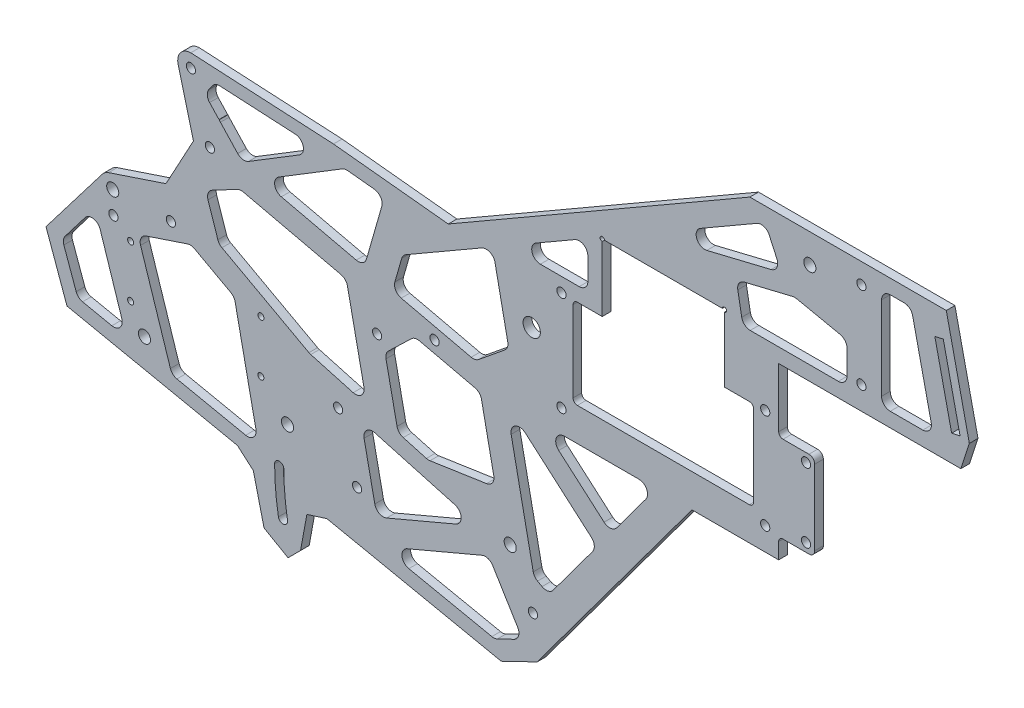
from build123d import *

# Parameters (mm, degrees)
SKETCH1_W            = 163.178820173
SKETCH1_H            = 83.61431582
BOSS_EXTRUDE1_DEPTH  = 3
SKETCH2_R            = 3
CUT_EXTRUDE1_DEPTH   = 70
SKETCH3_R            = 1.6
BOSS_EXTRUDE2_DEPTH  = 3
CUT_EXTRUDE2_DEPTH   = 10
SKETCH6_R            = 2.1
CUT_EXTRUDE3_DEPTH   = 10
SKETCH7_R            = 1.6
CUT_EXTRUDE4_DEPTH   = 10
SKETCH8_R            = 1.05
CUT_EXTRUDE5_DEPTH   = 10
CUT_EXTRUDE6_DEPTH   = 10
BOSS_EXTRUDE3_DEPTH  = 3
SKETCH11_R           = 1.599999999
CUT_EXTRUDE7_DEPTH   = 3
SKETCH12_R           = 1.6
CUT_EXTRUDE8_DEPTH   = 3
BOSS_EXTRUDE4_DEPTH  = 3
CUT_EXTRUDE11_DEPTH  = 3
CUT_EXTRUDE13_DEPTH  = 3
SKETCH19_R           = 1.6
CUT_EXTRUDE14_DEPTH  = 3
SKETCH20_R           = 1.6
CUT_EXTRUDE15_DEPTH  = 3
CUT_EXTRUDE16_DEPTH  = 10
FILLET2_R            = 3
BOSS_EXTRUDE5_DEPTH  = 3
CUT_EXTRUDE17_DEPTH  = 3
BOSS_EXTRUDE6_DEPTH  = 3
CUT_EXTRUDE18_DEPTH  = 3
SKETCH27_W           = 9.650782697
SKETCH27_H           = 7.834164778
BOSS_EXTRUDE7_DEPTH  = 3
SKETCH28_R           = 2.1
CUT_EXTRUDE19_DEPTH  = 3
BOSS_EXTRUDE8_START  = -3
BOSS_EXTRUDE8_DEPTH  = 3
CUT_EXTRUDE20_DEPTH  = 3
BOSS_EXTRUDE9_DEPTH  = 3
CUT_EXTRUDE21_DEPTH  = 10
BOSS_EXTRUDE10_DEPTH = 3
FILLET3_R            = 3
BOSS_EXTRUDE11_DEPTH = 3
CUT_EXTRUDE22_DEPTH  = 10
BOSS_EXTRUDE12_DEPTH = 3
BOSS_EXTRUDE13_DEPTH = 3
CUT_EXTRUDE23_DEPTH  = 3
FILLET4_R            = 3


with BuildPart() as part:
    # Sketch1 → Boss-Extrude1 (new body)
    with BuildSketch(Plane.XY):
        with Locations((-102.048100406, 5.79284209)):
            Rectangle(SKETCH1_W, SKETCH1_H)
    extrude(amount=BOSS_EXTRUDE1_DEPTH)

    # Sketch2 → Cut-Extrude1 (cut)
    with BuildSketch(Plane.XY.offset(3)):
        with Locations((-24.288671568, 24)):
            Circle(SKETCH2_R)
    extrude(amount=-CUT_EXTRUDE1_DEPTH, mode=Mode.SUBTRACT)

    # Sketch3 → Boss-Extrude2 (add)
    # profile 1 of 2: a face of its own
    with BuildSketch(Plane.XY.offset(3)):
        with BuildLine():
            Line((-20.45869032, -36.01431582), (-20.45869032, 47.6))
            Line((-20.45869032, 47.6), (-41.120184692, 47.6))
            Line((-41.120184692, 47.6), (51.371328432, 101))
            Line((51.371328432, 101), (121.371328432, 101))
            Line((121.371328432, 101), (121.371328432, 56))
            Line((121.371328432, 56), (61.371328432, 56))
            Line((61.371328432, 56), (61.371328432, 35.5))
            ThreePointArc((61.371328432, 35.5), (61.810668261, 34.439339828), (62.871328432, 34))
            Line((62.871328432, 34), (71.871328432, 34))
            ThreePointArc((71.871328432, 34), (73.285541995, 33.414213562), (73.871328432, 32))
            Line((73.871328432, 32), (73.871328432, 6))
            ThreePointArc((73.871328432, 6), (73.285541995, 4.585786438), (71.871328432, 4))
            Line((71.871328432, 4), (62.871328432, 4))
            ThreePointArc((62.871328432, 4), (61.810668261, 3.560660172), (61.371328432, 2.5))
            Line((61.371328432, 2.5), (61.371328432, -26))
            Line((61.371328432, -26), (-34.873017797, -81.566699204))
            Line((-34.873017797, -81.566699204), (-204.873017797, -81.566699204))
            Line((-204.873017797, -81.566699204), (-204.873017797, 47.6))
            Line((-204.873017797, 47.6), (-183.637510493, 47.6))
            Line((-183.637510493, 47.6), (-183.637510493, -36.01431582))
            Line((-183.637510493, -36.01431582), (-20.45869032, -36.01431582))
        make_face()
        with Locations((70.871328432, 31)):
            Circle(SKETCH3_R, mode=Mode.SUBTRACT)
        with Locations((70.871328432, 7)):
            Circle(SKETCH3_R, mode=Mode.SUBTRACT)
    # profile 2 of 2: a face of its own
    with BuildSketch(Plane.XY.offset(3)):
        with BuildLine():
            Line((-167.85268014, 47.6), (-120.724662995, 47.6))
            ThreePointArc((-120.724662995, 47.6), (-144.288671568, 57.35), (-167.85268014, 47.6))
        make_face()
    extrude(amount=-BOSS_EXTRUDE2_DEPTH)

    # Sketch4 → Cut-Extrude2 (cut)
    with BuildSketch(Plane.XY.offset(3)):
        with BuildLine():
            Line((0.171328432, 62.05), (0.171328432, 39.5))
            Line((0.171328432, 39.5), (-8.45869032, 39.5))
            ThreePointArc((-8.45869032, 39.5), (-9.519350491, 39.060660172), (-9.95869032, 38))
            Line((-9.95869032, 38), (-9.95869032, 10))
            ThreePointArc((-9.95869032, 10), (-9.519350491, 8.939339828), (-8.45869032, 8.5))
            Line((-8.45869032, 8.5), (51.201347185, 8.5))
            ThreePointArc((51.201347185, 8.5), (52.262007356, 8.939339828), (52.701347185, 10))
            Line((52.701347185, 10), (52.701347185, 38))
            ThreePointArc((52.701347185, 38), (52.262007356, 39.060660172), (51.201347185, 39.5))
            Line((51.201347185, 39.5), (42.571328432, 39.5))
            Line((42.571328432, 39.5), (42.571328432, 62.05))
            ThreePointArc((42.571328432, 62.05), (43.101658518, 63.330330086), (41.821328432, 62.8))
            Line((41.821328432, 62.8), (0.921328432, 62.8))
            ThreePointArc((0.921328432, 62.8), (-0.359001653, 63.330330086), (0.171328432, 62.05))
        make_face()
    extrude(amount=-CUT_EXTRUDE2_DEPTH, mode=Mode.SUBTRACT)

    # Sketch6 → Cut-Extrude3 (cut)
    with BuildSketch(Plane(origin=(0, 0, 0), x_dir=(-1, 0, 0), z_dir=(0, 0, -1))):
        with Locations((158.638149135, -45.925703464)):
            Circle(SKETCH6_R)
        with Locations((169.638438212, -7.233826143)):
            Circle(SKETCH6_R)
        with Locations((109.011892198, -47.513424086)):
            Circle(SKETCH6_R)
        with Locations((31.755599014, -45.033004622)):
            Circle(SKETCH6_R)
        with Locations((-71.971715393, 91)):
            Circle(SKETCH6_R)
    extrude(amount=-CUT_EXTRUDE3_DEPTH, mode=Mode.SUBTRACT)

    # Sketch7 → Cut-Extrude4 (cut)
    with BuildSketch(Plane.XY.offset(3)):
        with Locations((56.701347185, 5)):
            Circle(SKETCH7_R)
        with Locations((-13.95869032, 5)):
            Circle(SKETCH7_R)
        with Locations((56.701347185, 39.6)):
            Circle(SKETCH7_R)
        with Locations((-13.95869032, 39.6)):
            Circle(SKETCH7_R)
    extrude(amount=-CUT_EXTRUDE4_DEPTH, mode=Mode.SUBTRACT)

    # Sketch8 → Cut-Extrude5 (cut)
    with BuildSketch(Plane(origin=(0, 0, 0), x_dir=(-1, 0, 0), z_dir=(0, 0, -1))):
        with Locations((163.428671568, -37.666699204)):
            Circle(SKETCH8_R)
        with Locations((163.428671568, -19.666699204)):
            Circle(SKETCH8_R)
        with Locations((118.228671568, -37.666699204)):
            Circle(SKETCH8_R)
        with Locations((118.228671568, -19.666699204)):
            Circle(SKETCH8_R)
    extrude(amount=-CUT_EXTRUDE5_DEPTH, mode=Mode.SUBTRACT)

    # Sketch9 → Cut-Extrude6 (cut)
    with BuildSketch(Plane(origin=(0, 0, 0), x_dir=(-1, 0, 0), z_dir=(0, 0, -1))):
        Polygon((-121.371328432, 56), (-118.426654556, 56), (-121.371328432, 65.062774312), align=None)
        Polygon((-121.371328432, 101), (-121.371328432, 65.062774312), (-113.371328432, 101), align=None)
        Polygon((-61.371328432, -26), (-17.266880789, -51.463714719), (-61.371328432, 0.5), align=None)
        Polygon((120.863159172, -67.292179678), (117.404541062, -81.566699204), (204.873017797, -81.566699204), (204.873017797, 23.999750834), (177.638416387, 23.999750834), (177.638416387, -10.155091534), (192.781858404, -29.966985111), (185.497426915, -50.178485254), (126.348521803, -62.504365896), align=None)
        Polygon((95.344552433, -68.965199366), (34.873017797, -81.566699204), (104.200298052, -81.566699204), (102.285728481, -71.163480303), align=None)
        with BuildLine():
            Line((-83.571328432, 61), (-50.244806955, 61))
            ThreePointArc((-50.244806955, 61), (-49.282311579, 61.349520686), (-48.768365596, 62.235196464))
            Line((-48.768365596, 62.235196464), (-46.599577608, 74.327513426))
            ThreePointArc((-46.599577608, 74.327513426), (-46.819419687, 75.411437373), (-47.722417082, 76.050043173))
            Line((-47.722417082, 76.050043173), (-65.520386191, 80.367311648))
            ThreePointArc((-65.520386191, 80.367311648), (-65.90752568, 80.409210466), (-66.292404996, 80.350046224))
            Line((-66.292404996, 80.350046224), (-83.989745353, 75.209422674))
            ThreePointArc((-83.989745353, 75.209422674), (-84.770833618, 74.669621261), (-85.071328432, 73.768961886))
            Line((-85.071328432, 73.768961886), (-85.071328432, 62.5))
            ThreePointArc((-85.071328432, 62.5), (-84.631988604, 61.439339828), (-83.571328432, 61))
        make_face()
        with BuildLine():
            Line((-59.519671277, 85.08571202), (-25.314151563, 76.788450066))
            ThreePointArc((-25.314151563, 76.788450066), (-23.567990796, 77.688700037), (-24.210549679, 79.545214383))
            Line((-24.210549679, 79.545214383), (-54.279336826, 96.905436737))
            ThreePointArc((-54.279336826, 96.905436737), (-55.48620894, 97.035128092), (-56.393908981, 96.229249204))
            Line((-56.393908981, 96.229249204), (-60.530641547, 87.166288803))
            ThreePointArc((-60.530641547, 87.166288803), (-60.515228555, 85.887870115), (-59.519671277, 85.08571202))
        make_face()
    extrude(amount=-CUT_EXTRUDE6_DEPTH, mode=Mode.SUBTRACT)

    # Sketch10 → Boss-Extrude3 (add)
    with BuildSketch(Plane.XY.offset(3)):
        Polygon((17.266880789, -51.463714719), (10.205824418, -59.783091395), (-34.873017797, -81.566699204), align=None)
    extrude(amount=-BOSS_EXTRUDE3_DEPTH)

    # Sketch11 → Cut-Extrude7 (cut)
    with BuildSketch(Plane(origin=(0, 0, 0), x_dir=(-1, 0, 0), z_dir=(0, 0, -1))):
        with Locations((23.873017796, -61.566699204)):
            Circle(SKETCH11_R)
        with BuildLine():
            Line((182.025550468, -45.065004546), (186.87611918, -31.606539001))
            ThreePointArc((186.87611918, -31.606539001), (186.947368829, -30.868815154), (186.656707601, -30.187031436))
            Line((186.656707601, -30.187031436), (177.493744222, -18.199290795))
            ThreePointArc((177.493744222, -18.199290795), (176.049674571, -17.631583295), (174.875617511, -18.646087598))
            Line((174.875617511, -18.646087598), (165.680025858, -46.907186583))
            ThreePointArc((165.680025858, -46.907186583), (165.989490672, -48.37254203), (167.412424949, -48.839760499))
            Line((167.412424949, -48.839760499), (180.920411269, -46.0248677))
            ThreePointArc((180.920411269, -46.0248677), (181.598013954, -45.688893065), (182.025550468, -45.065004546))
        make_face()
        with BuildLine():
            ThreePointArc((112.161770205, -76.839426476), (110.312458067, -78.143284068), (109.008600476, -76.293971931))
            ThreePointArc((109.008600476, -76.293971931), (109.956333089, -68.957425033), (110.273017797, -61.566699204))
            ThreePointArc((110.273017797, -61.566699204), (111.873017797, -59.966699204), (113.473017797, -61.566699204))
            ThreePointArc((113.473017797, -61.566699204), (113.144604026, -69.231155619), (112.161770205, -76.839426476))
        make_face()
    extrude(amount=-CUT_EXTRUDE7_DEPTH, mode=Mode.SUBTRACT)

    # Sketch12 → Cut-Extrude8 (cut)
    with BuildSketch(Plane(origin=(0, 0, 0), x_dir=(-1, 0, 0), z_dir=(0, 0, -1))):
        with Locations((-90.071328432, 94)):
            Circle(SKETCH12_R)
        with Locations((-90.071328432, 64)):
            Circle(SKETCH12_R)
    extrude(amount=-CUT_EXTRUDE8_DEPTH, mode=Mode.SUBTRACT)

    # Sketch15 → Boss-Extrude4 (add)
    with BuildSketch(Plane.XY.offset(3)):
        Polygon((-104.200298052, -81.566699204), (-117.404541062, -81.566699204), (-117.138244406, -82.665767299), (-108.829298455, -87.46293948), (-104.486117245, -83.11975827), align=None)
    extrude(amount=-BOSS_EXTRUDE4_DEPTH)

    # Sketch16 → Cut-Extrude11 (cut)
    with BuildSketch(Plane(origin=(0, 0, 0), x_dir=(-1, 0, 0), z_dir=(0, 0, -1))):
        with BuildLine():
            Line((11.269813629, -56.833195156), (-11.308333697, -45.922677445))
            ThreePointArc((-11.308333697, -45.922677445), (-11.573688093, -45.758389309), (-11.799301923, -45.542746209))
            Line((-11.799301923, -45.542746209), (-23.657583502, -31.571343289))
            ThreePointArc((-23.657583502, -31.571343289), (-23.983253255, -30.298686205), (-23.182005599, -29.257667936))
            Line((-23.182005599, -29.257667936), (27.44914468, -4.073328722))
            ThreePointArc((27.44914468, -4.073328722), (29.031447568, -4.227194459), (29.586779853, -5.716812915))
            Line((29.586779853, -5.716812915), (22.360247475, -41.063740234))
            ThreePointArc((22.360247475, -41.063740234), (22.286714803, -41.311914547), (22.171611839, -41.543752532))
            Line((22.171611839, -41.543752532), (13.203422842, -56.263085058))
            ThreePointArc((13.203422842, -56.263085058), (12.346666546, -56.921384552), (11.269813629, -56.833195156))
        make_face()
        with BuildLine():
            Line((0.460063561, -6.329141418), (-30.511103642, -21.734447764))
            ThreePointArc((-30.511103642, -21.734447764), (-31.481149764, -21.86069911), (-32.322749626, -21.362062417))
            Line((-32.322749626, -21.362062417), (-41.014940376, -11.120941188))
            ThreePointArc((-41.014940376, -11.120941188), (-41.279415418, -10.66729816), (-41.371328432, -10.150296184))
            Line((-41.371328432, -10.150296184), (-41.371328432, -1))
            ThreePointArc((-41.371328432, -1), (-40.931988604, 0.060660172), (-39.871328432, 0.5))
            Line((-39.871328432, 0.5), (-2.774938255, 0.5))
            ThreePointArc((-2.774938255, 0.5), (-2.05667802, 0.316853156), (-1.513813912, -0.187863686))
            Line((-1.513813912, -0.187863686), (1.053153863, -4.173974755))
            ThreePointArc((1.053153863, -4.173974755), (1.238265619, -5.384107483), (0.460063561, -6.329141418))
        make_face()
    extrude(amount=-CUT_EXTRUDE11_DEPTH, mode=Mode.SUBTRACT)

    # Sketch18 → Cut-Extrude13 (cut)
    with BuildSketch(Plane(origin=(0, 0, 0), x_dir=(-1, 0, 0), z_dir=(0, 0, -1))):
        with BuildLine():
            Line((7.078671568, 61.480374074), (31.641465984, 47.299038106))
            ThreePointArc((31.641465984, 47.299038106), (32.340354723, 45.611771432), (30.891465984, 44.5))
            Line((30.891465984, 44.5), (6.328671568, 44.5))
            ThreePointArc((6.328671568, 44.5), (5.268011396, 44.939339828), (4.828671568, 46))
            Line((4.828671568, 46), (4.828671568, 60.181335968))
            ThreePointArc((4.828671568, 60.181335968), (5.578671568, 61.480374074), (7.078671568, 61.480374074))
        make_face()
    extrude(amount=-CUT_EXTRUDE13_DEPTH, mode=Mode.SUBTRACT)

    # Sketch19 → Cut-Extrude14 (cut)
    with BuildSketch(Plane.XY.offset(3)):
        with Locations((-91.456581964, -33.768910916)):
            Circle(SKETCH19_R)
        with Locations((-77.932797588, -4.767061731)):
            Circle(SKETCH19_R)
        with Locations((-149.460280334, -6.721342165)):
            Circle(SKETCH19_R)
        with Locations((-135.936495958, 22.28050702)):
            Circle(SKETCH19_R)
    extrude(amount=-CUT_EXTRUDE14_DEPTH, mode=Mode.SUBTRACT)

    # Sketch20 → Cut-Extrude15 (cut)
    with BuildSketch(Plane.XY.offset(3)):
        with Locations((-84.882257407, -54.288012188)):
            Circle(SKETCH20_R)
        with Locations((-169.404718208, -14.874541431)):
            Circle(SKETCH20_R)
        with Locations((-57.988359714, 3.386137535)):
            Circle(SKETCH20_R)
        with Locations((-142.510820515, 42.799608292)):
            Circle(SKETCH20_R)
    extrude(amount=-CUT_EXTRUDE15_DEPTH, mode=Mode.SUBTRACT)

    # Sketch22 → Cut-Extrude16 (cut)
    with BuildSketch(Plane.XY.offset(3)):
        Polygon((-76.323063278, -67.821626648), (-37.12340227, -75.990338172), (-27.451490646, -71.316546228), (-39.179035785, -52.068330489), align=None)
        Polygon((-77.983418544, -59.836051226), (-42.685868934, -44.865871894), (-83.448422948, -33.551794033), align=None)
        Polygon((-149.086127131, -52.658728223), (-119.028870525, -58.922278776), (-127.462526406, -18.360119284), (-142.442614642, -10.200196554), (-160.898506599, -16.355373525), align=None)
        Polygon((-70.641334575, -30.879704934), (-60.206198021, -33.776087418), (-36.814607718, -30.27291745), (-42.103534989, -4.403341551), (-64.859698343, 0.873326667), (-75.175214792, -9.073743787), align=None)
        Polygon((-101.272422836, -22.377722516), (-81.48074435, -27.871112143), (-88.601929516, 6.37864295), (-125.455396048, 14.924174661), (-137.395178961, 8.598466493), (-132.790132757, -5.209460651), align=None)
        Polygon((-72.633756132, 10.888219669), (-43.866051353, 4.2176034), (-32.236910384, 13.698978577), (-37.532266562, 39.6), (-64.39852118, 39.6), align=None)
        Polygon((-124.003413949, 22.799746078), (-82.388214325, 13.150070172), (-74.801732954, 39.6), (-129.551973108, 39.6), (-133.929024166, 33.445565282), align=None)
        with BuildLine():
            ThreePointArc((-173.278699338, -4.451351915), (-172.300812969, -3.504828349), (-171.088038255, -2.887296078))
            Line((-171.088038255, -2.887296078), (-151.16672967, 3.756608217))
            Line((-151.16672967, 3.756608217), (-141.642344482, 21.323123168))
            Line((-141.642344482, 21.323123168), (-146.944270243, 41.642807792))
            ThreePointArc((-146.944270243, 41.642807792), (-146.150685692, 45.582600456), (-142.556724513, 47.381262657))
            Line((-142.556724513, 47.381262657), (-120.724662995, 47.6))
            Line((-120.724662995, 47.6), (-129.551973108, 69.988968949))
            Line((-129.551973108, 69.988968949), (-217.973119112, 55.746414592))
            Line((-217.973119112, 55.746414592), (-212.066553709, -12.704566552))
            Line((-212.066553709, -12.704566552), (-177.638416387, -10.155091534))
            Line((-177.638416387, -10.155091534), (-173.278699338, -4.451351915))
        make_face()
    extrude(amount=-CUT_EXTRUDE16_DEPTH, mode=Mode.SUBTRACT)

    # Fillet2
    fillet2_edges = [part.edges().sort_by_distance(p)[0] for p in [
        (-37.532266562, 39.6, 1.5),
        (-64.39852118, 39.6, 1.5),
        (-32.236910384, 13.698978577, 1.5),
        (-43.866051353, 4.2176034, 1.5),
        (-82.388214325, 13.150070172, 1.5),
        (-72.633756132, 10.888219669, 1.5),
        (-124.003413949, 22.799746078, 1.5),
        (-132.790132757, -5.209460651, 1.5),
        (-101.272422836, -22.377722516, 1.5),
        (-81.48074435, -27.871112143, 1.5),
        (-133.929024166, 33.445565282, 1.5),
        (-129.551973108, 39.6, 1.5),
        (-137.395178961, 8.598466493, 1.5),
        (-160.898506599, -16.355373525, 1.5),
        (-88.601929516, 6.37864295, 1.5),
        (-74.801732954, 39.6, 1.5),
        (-125.455396048, 14.924174661, 1.5),
        (-142.442614642, -10.200196554, 1.5),
        (-127.462526406, -18.360119284, 1.5),
        (-119.028870525, -58.922278776, 1.5),
        (-149.086127131, -52.658728223, 1.5),
        (-70.641334575, -30.879704934, 1.5),
        (-60.206198021, -33.776087418, 1.5),
        (-42.103534989, -4.403341551, 1.5),
        (-36.814607718, -30.27291745, 1.5),
        (-64.859698343, 0.873326667, 1.5),
        (-75.175214792, -9.073743787, 1.5),
        (-83.448422948, -33.551794033, 1.5),
        (-77.983418544, -59.836051226, 1.5),
        (-76.323063278, -67.821626648, 1.5),
        (-39.179035785, -52.068330489, 1.5),
        (-42.685868934, -44.865871894, 1.5),
        (-37.12340227, -75.990338172, 1.5),
        (-27.451490646, -71.316546228, 1.5),
    ]]
    fillet(fillet2_edges, radius=FILLET2_R)

    # Sketch23 → Boss-Extrude5 (add)
    with BuildSketch(Plane.XY.offset(3)):
        Polygon((-15.130171081, -62.379709124), (12.218349603, -50.696677847), (46.16570151, -12.476032853), (46.16570151, 2.450417003), (-9.12929613, 2.450417003), (-16.222708995, -2.830663341), (-26.155021538, 1.279347742), (-39.106449794, -4.253380816), align=None)
        Polygon((61.371328432, 0.5), (52.84665155, -9.543746181), (61.371328432, -9.543746181), align=None)
    extrude(amount=-BOSS_EXTRUDE5_DEPTH)

    # Sketch24 → Cut-Extrude17 (cut)
    with BuildSketch(Plane.XY.offset(3)):
        Polygon((61.371328432, -3), (31.291839697, -3), (-22.417752101, -75.547897261), (68.077642892, -67.653931132), align=None)
        with BuildLine():
            Line((-17.629067029, -52.273335738), (-2.34146226, -31.623698624))
            ThreePointArc((-2.34146226, -31.623698624), (-2.055985305, -30.567540627), (-2.563723837, -29.59843362))
            Line((-2.563723837, -29.59843362), (-29.865870718, -5.898001252))
            ThreePointArc((-29.865870718, -5.898001252), (-31.605904572, -5.735610031), (-32.318781219, -7.331196321))
            Line((-32.318781219, -7.331196321), (-23.627770884, -49.841282013))
            ThreePointArc((-23.627770884, -49.841282013), (-23.367180513, -50.428686818), (-22.884695427, -50.853139277))
            Line((-22.884695427, -50.853139277), (-19.561163649, -52.693123067))
            ThreePointArc((-19.561163649, -52.693123067), (-18.51616279, -52.846613295), (-17.629067029, -52.273335738))
        make_face()
        with BuildLine():
            Line((2.034593997, -22.996368805), (-17.967754618, -5.632741226))
            ThreePointArc((-17.967754618, -5.632741226), (-18.389634175, -3.975172333), (-16.984445249, -3))
            Line((-16.984445249, -3), (15.872767319, -3))
            ThreePointArc((15.872767319, -3), (17.212316808, -3.82501321), (17.078338265, -5.392523778))
            Line((17.078338265, -5.392523778), (4.223474312, -22.756151357))
            ThreePointArc((4.223474312, -22.756151357), (3.178784817, -23.329592037), (2.034593997, -22.996368805))
        make_face()
    extrude(amount=-CUT_EXTRUDE17_DEPTH, mode=Mode.SUBTRACT)

    # Sketch25 → Boss-Extrude6 (add)
    with BuildSketch(Plane.XY.offset(3)):
        Polygon((87.562238944, 58.571443712), (87.562238944, 78.331009911), (64.47098659, 87.209025051), (55.937710434, 98.978238666), (45.578157064, 95.342342497), (17.678746454, 75.113856285), (44.965218407, 66.833844625), (48.684115418, 56.237801646), align=None)
    extrude(amount=-BOSS_EXTRUDE6_DEPTH)

    # Sketch26 → Cut-Extrude18 (cut)
    with BuildSketch(Plane.XY.offset(3)):
        with BuildLine():
            Line((26.314151563, 75.056399258), (60.519671277, 83.353661212))
            ThreePointArc((60.519671277, 83.353661212), (61.515228555, 84.155819307), (61.530641547, 85.434237996))
            Line((61.530641547, 85.434237996), (57.393908981, 94.497198396))
            ThreePointArc((57.393908981, 94.497198396), (56.48620894, 95.303077285), (55.279336826, 95.17338593))
            Line((55.279336826, 95.17338593), (25.210549678, 77.813163576))
            ThreePointArc((25.210549678, 77.813163576), (24.567990796, 75.956649229), (26.314151563, 75.056399258))
        make_face()
        with BuildLine():
            Line((50.244806955, 61), (83.571328432, 61))
            ThreePointArc((83.571328432, 61), (84.631988604, 61.439339828), (85.071328432, 62.5))
            Line((85.071328432, 62.5), (85.071328432, 73.678847041))
            ThreePointArc((85.071328432, 73.678847041), (84.736390897, 74.623637735), (83.881155827, 75.146500606))
            Line((83.881155827, 75.146500606), (67.241535496, 78.659189389))
            ThreePointArc((67.241535496, 78.659189389), (66.909265072, 78.691367919), (66.578106217, 78.649262036))
            Line((66.578106217, 78.649262036), (48.06180521, 74.157747182))
            ThreePointArc((48.06180521, 74.157747182), (47.158807815, 73.519141383), (46.938965735, 72.435217435))
            Line((46.938965735, 72.435217435), (48.768365596, 62.235196464))
            ThreePointArc((48.768365596, 62.235196464), (49.282311579, 61.349520686), (50.244806955, 61))
        make_face()
    extrude(amount=-CUT_EXTRUDE18_DEPTH, mode=Mode.SUBTRACT)

    # Sketch27 → Boss-Extrude7 (add)
    with BuildSketch(Plane.XY.offset(3)):
        with Locations((71.749775252, 91.852073015)):
            Rectangle(SKETCH27_W, SKETCH27_H)
    extrude(amount=-BOSS_EXTRUDE7_DEPTH)

    # Sketch28 → Cut-Extrude19 (cut)
    with BuildSketch(Plane.XY.offset(3)):
        with Locations((72.181131449, 91)):
            Circle(SKETCH28_R)
    extrude(amount=-CUT_EXTRUDE19_DEPTH, mode=Mode.SUBTRACT)

    # Sketch29 → Boss-Extrude8 (add)
    with BuildSketch(Plane.XY.offset(3).offset(BOSS_EXTRUDE8_START)):
        with BuildLine():
            Line((-7.078671568, 59.170972997), (-27.641465984, 47.299038106))
            ThreePointArc((-27.641465984, 47.299038106), (-28.340354723, 45.611771432), (-26.891465984, 44.5))
            Line((-26.891465984, 44.5), (-30.891465984, 44.5))
            ThreePointArc((-30.891465984, 44.5), (-32.340354723, 45.611771432), (-31.641465984, 47.299038106))
            Line((-31.641465984, 47.299038106), (-7.078671568, 61.480374074))
            ThreePointArc((-7.078671568, 61.480374074), (-5.578671568, 61.480374074), (-4.828671568, 60.181335968))
            Line((-4.828671568, 60.181335968), (-4.828671568, 57.871934892))
            ThreePointArc((-4.828671568, 57.871934892), (-5.578671568, 59.170972997), (-7.078671568, 59.170972997))
        make_face()
    extrude(amount=BOSS_EXTRUDE8_DEPTH)

    # Sketch30 → Cut-Extrude20 (cut)
    with BuildSketch(Plane(origin=(0, 0, 0), x_dir=(-1, 0, 0), z_dir=(0, 0, -1))):
        Polygon((41.120184692, 47.6), (120.724662995, 47.6), (53.244540345, 40.6), align=None)
    extrude(amount=-CUT_EXTRUDE20_DEPTH, mode=Mode.SUBTRACT)

    # Sketch31 → Boss-Extrude9 (add)
    with BuildSketch(Plane.XY.offset(3)):
        with BuildLine():
            Line((-53.244540345, 40.6), (-63.53780738, 41.667764349))
            Line((-63.53780738, 41.667764349), (-125.927088694, 45.633439627))
            Line((-125.927088694, 45.633439627), (-133.038244376, 39.986953178))
            Line((-133.038244376, 39.986953178), (-132.487405602, 35.472580096))
            Line((-132.487405602, 35.472580096), (-130.653827301, 38.05071725))
            ThreePointArc((-130.653827301, 38.05071725), (-129.444972632, 39.045591339), (-127.899525418, 39.295984977))
            Line((-127.899525418, 39.295984977), (-79.981949284, 34.325291094))
            ThreePointArc((-79.981949284, 34.325291094), (-77.805454438, 33.020476194), (-77.407766217, 30.514180956))
            Line((-77.407766217, 30.514180956), (-81.517401655, 16.186119808))
            Line((-81.517401655, 16.186119808), (-71.414778277, 15.138131736))
            Line((-71.414778277, 15.138131736), (-69.381055832, 22.228614575))
            ThreePointArc((-69.381055832, 22.228614575), (-68.861295973, 23.24856292), (-67.997331012, 23.999568568))
            Line((-67.997331012, 23.999568568), (-41.672743575, 39.198076211))
            ThreePointArc((-41.672743575, 39.198076211), (-40.94920071, 39.497777479), (-40.172743575, 39.6))
            Line((-40.172743575, 39.6), (-32.700810506, 39.6))
            Line((-32.700810506, 39.6), (-43.538976165, 46.203510092))
            Line((-43.538976165, 46.203510092), (-53.244540345, 40.6))
        make_face()
    extrude(amount=-BOSS_EXTRUDE9_DEPTH)

    # Sketch32 → Cut-Extrude21 (cut)
    with BuildSketch(Plane.XY.offset(3)):
        with BuildLine():
            Line((-77.407766217, 30.514180956), (-76.287640468, 34.419449552))
            ThreePointArc((-76.287640468, 34.419449552), (-76.685328689, 36.92574479), (-78.861823535, 38.230559689))
            Line((-78.861823535, 38.230559689), (-120.788969479, 42.579840783))
            ThreePointArc((-120.788969479, 42.579840783), (-120.958543369, 42.592585917), (-121.128566987, 42.595702301))
            Line((-121.128566987, 42.595702301), (-132.63020964, 42.480466333))
            ThreePointArc((-132.63020964, 42.480466333), (-133.988962785, 42.139791548), (-135.044914015, 41.219337086))
            Line((-135.044914015, 41.219337086), (-136.279905751, 39.482853798))
            ThreePointArc((-136.279905751, 39.482853798), (-136.82859447, 37.545982173), (-136.029389382, 35.698334417))
            Line((-136.029389382, 35.698334417), (-132.78264069, 32.215999446))
            Line((-132.78264069, 32.215999446), (-77.407766217, 30.514180956))
        make_face()
    extrude(amount=-CUT_EXTRUDE21_DEPTH, mode=Mode.SUBTRACT)

    # Sketch33 → Boss-Extrude10 (add)
    with BuildSketch(Plane.XY.offset(3)):
        Polygon((-118.300508761, 21.477364178), (-89.15005729, 39.297801915), (-97.345572671, 40.147957567), (-124.627904749, 23.469550352), (-125.921617814, 20.336912244), align=None)
    extrude(amount=-BOSS_EXTRUDE10_DEPTH)

    # Fillet3
    fillet3_edges = [part.edges().sort_by_distance(p)[0] for p in [
        (-118.300508761, 21.477364178, 1.5),
        (-124.627904749, 23.469550352, 1.5),
        (-97.345572671, 40.147957567, 1.5),
        (-89.15005729, 39.297801915, 1.5),
    ]]
    fillet(fillet3_edges, radius=FILLET3_R)

    # Sketch34 → Boss-Extrude11 (add)
    with BuildSketch(Plane.XY.offset(3)):
        with BuildLine():
            Line((83.571328432, 61), (82.071328432, 61))
            ThreePointArc((82.071328432, 61), (84.192648776, 61.878679656), (85.071328432, 64))
            Line((85.071328432, 64), (85.071328432, 62.5))
            ThreePointArc((85.071328432, 62.5), (84.631988604, 61.439339828), (83.571328432, 61))
        make_face()
        with BuildLine():
            Line((85.071328432, 72.462443558), (85.071328432, 73.678847041))
            ThreePointArc((85.071328432, 73.678847041), (84.736390897, 74.623637735), (83.881155827, 75.146500606))
            Line((83.881155827, 75.146500606), (82.690983222, 75.397750687))
            ThreePointArc((82.690983222, 75.397750687), (84.401453361, 74.352024945), (85.071328432, 72.462443558))
        make_face()
        with BuildLine():
            Line((67.574375818, 78.588925499), (67.241535496, 78.659189389))
            ThreePointArc((67.241535496, 78.659189389), (66.909265072, 78.691367919), (66.578106217, 78.649262036))
            Line((66.578106217, 78.649262036), (66.24751726, 78.569070792))
            ThreePointArc((66.24751726, 78.569070792), (66.9102324, 78.626722939), (67.574375818, 78.588925499))
        make_face()
        with BuildLine():
            Line((51.499712668, 61), (50.244806955, 61))
            ThreePointArc((50.244806955, 61), (49.282311579, 61.349520686), (48.768365596, 62.235196464))
            Line((48.768365596, 62.235196464), (48.546829949, 63.470392929))
            ThreePointArc((48.546829949, 63.470392929), (49.574721917, 61.699041372), (51.499712668, 61))
        make_face()
        with BuildLine():
            Line((47.188212287, 71.045515761), (46.938965735, 72.435217435))
            ThreePointArc((46.938965735, 72.435217435), (47.158807815, 73.519141383), (48.06180521, 74.157747182))
            Line((48.06180521, 74.157747182), (49.433891236, 74.490575255))
            ThreePointArc((49.433891236, 74.490575255), (47.627896445, 73.213363656), (47.188212287, 71.045515761))
        make_face()
        with BuildLine():
            Line((60.519671277, 83.353661212), (58.754476807, 82.925476491))
            ThreePointArc((58.754476807, 82.925476491), (60.745591363, 84.529792682), (60.776417347, 87.086630058))
            Line((60.776417347, 87.086630058), (61.530641547, 85.434237996))
            ThreePointArc((61.530641547, 85.434237996), (61.515228555, 84.155819307), (60.519671277, 83.353661212))
        make_face()
        with BuildLine():
            Line((58.079204904, 92.995817846), (57.393908981, 94.497198396))
            ThreePointArc((57.393908981, 94.497198396), (56.48620894, 95.303077285), (55.279336826, 95.17338593))
            Line((55.279336826, 95.17338593), (53.850060595, 94.348192913))
            ThreePointArc((53.850060595, 94.348192913), (56.263804823, 94.607575623), (58.079204904, 92.995817846))
        make_face()
        with BuildLine():
            Line((36.451958598, 77.515535717), (26.314151563, 75.056399258))
            ThreePointArc((26.314151563, 75.056399258), (24.567990796, 75.956649229), (25.210549678, 77.813163576))
            Line((25.210549678, 77.813163576), (34.244754829, 83.029064351))
            ThreePointArc((34.244754829, 83.029064351), (32.959637063, 79.316035659), (36.451958598, 77.515535717))
        make_face()
        with BuildLine():
            Line((-6.328671568, 44.5), (-7.828671568, 44.5))
            ThreePointArc((-7.828671568, 44.5), (-5.707351224, 45.378679656), (-4.828671568, 47.5))
            Line((-4.828671568, 47.5), (-4.828671568, 46))
            ThreePointArc((-4.828671568, 46), (-5.268011396, 44.939339828), (-6.328671568, 44.5))
        make_face()
        with BuildLine():
            Line((-4.828671568, 55.27385868), (-4.828671568, 57.871934892))
            ThreePointArc((-4.828671568, 57.871934892), (-5.578671568, 59.170972997), (-7.078671568, 59.170972997))
            Line((-7.078671568, 59.170972997), (-9.328671568, 57.871934892))
            ThreePointArc((-9.328671568, 57.871934892), (-6.328671568, 57.871934892), (-4.828671568, 55.27385868))
        make_face()
        with BuildLine():
            Line((-22.793389772, 50.098076211), (-27.641465984, 47.299038106))
            ThreePointArc((-27.641465984, 47.299038106), (-28.340354723, 45.611771432), (-26.891465984, 44.5))
            Line((-26.891465984, 44.5), (-21.293389772, 44.5))
            ThreePointArc((-21.293389772, 44.5), (-24.191167251, 46.723542865), (-22.793389772, 50.098076211))
        make_face()
        with BuildLine():
            Line((5.188102508, -21.453185817), (4.223474312, -22.756151357))
            ThreePointArc((4.223474312, -22.756151357), (3.178784817, -23.329592037), (2.034593997, -22.996368805))
            Line((2.034593997, -22.996368805), (0.810341879, -21.933620712))
            ThreePointArc((0.810341879, -21.933620712), (3.104229055, -22.650234062), (5.188102508, -21.453185817))
        make_face()
        with BuildLine():
            Line((15.307074309, -7.785047557), (17.078338265, -5.392523778))
            ThreePointArc((17.078338265, -5.392523778), (17.212316808, -3.82501321), (15.872767319, -3))
            Line((15.872767319, -3), (12.895932418, -3))
            ThreePointArc((12.895932418, -3), (15.575031396, -4.650026421), (15.307074309, -7.785047557))
        make_face()
        with BuildLine():
            Line((-14.934920172, -8.265482452), (-17.967754618, -5.632741226))
            ThreePointArc((-17.967754618, -5.632741226), (-18.389634175, -3.975172333), (-16.984445249, -3))
            Line((-16.984445249, -3), (-12.968301435, -3))
            ThreePointArc((-12.968301435, -3), (-15.778679288, -4.950344665), (-14.934920172, -8.265482452))
        make_face()
        with BuildLine():
            Line((-31.433286133, -11.662392642), (-32.318781219, -7.331196321))
            ThreePointArc((-32.318781219, -7.331196321), (-31.605904572, -5.735610031), (-29.865870718, -5.898001252))
            Line((-29.865870718, -5.898001252), (-26.527465131, -8.796002504))
            ThreePointArc((-26.527465131, -8.796002504), (-30.007532839, -8.471220063), (-31.433286133, -11.662392642))
        make_face()
        with BuildLine():
            Line((-3.16727131, -32.739155066), (-2.34146226, -31.623698624))
            ThreePointArc((-2.34146226, -31.623698624), (-2.055985305, -30.567540627), (-2.563723837, -29.59843362))
            Line((-2.563723837, -29.59843362), (-3.611794464, -28.688625057))
            ThreePointArc((-3.611794464, -28.688625057), (-2.5963174, -30.626839071), (-3.16727131, -32.739155066))
        make_face()
        with BuildLine():
            Line((-17.629067029, -52.273335738), (-16.846948519, -51.216894022))
            ThreePointArc((-16.846948519, -51.216894022), (-18.62114004, -52.363449137), (-20.71114176, -52.056468682))
            Line((-20.71114176, -52.056468682), (-19.561163649, -52.693123067))
            ThreePointArc((-19.561163649, -52.693123067), (-18.51616279, -52.846613295), (-17.629067029, -52.273335738))
        make_face()
        with BuildLine():
            Line((-22.280052961, -51.187883282), (-22.884695427, -50.853139277))
            ThreePointArc((-22.884695427, -50.853139277), (-23.367180513, -50.428686818), (-23.627770884, -49.841282013))
            Line((-23.627770884, -49.841282013), (-23.766203876, -49.164168752))
            ThreePointArc((-23.766203876, -49.164168752), (-23.245023132, -50.338978364), (-22.280052961, -51.187883282))
        make_face()
        with BuildLine():
            Line((-186.598753614, -32.376121938), (-186.87611918, -31.606539001))
            ThreePointArc((-186.87611918, -31.606539001), (-186.947368829, -30.868815154), (-186.656707601, -30.187031436))
            Line((-186.656707601, -30.187031436), (-186.159930456, -29.537106807))
            ThreePointArc((-186.159930456, -29.537106807), (-186.741252913, -30.900674243), (-186.598753614, -32.376121938))
        make_face()
        with BuildLine():
            Line((-173.991914463, -21.361999771), (-174.875617511, -18.646087598))
            ThreePointArc((-174.875617511, -18.646087598), (-176.049674571, -17.631583295), (-177.493744222, -18.199290795))
            Line((-177.493744222, -18.199290795), (-179.228167886, -20.468406165))
            ThreePointArc((-179.228167886, -20.468406165), (-176.340028584, -19.332991166), (-173.991914463, -21.361999771))
        make_face()
        with BuildLine():
            Line((-165.680025858, -46.907186583), (-166.480594366, -44.446774388))
            ThreePointArc((-166.480594366, -44.446774388), (-167.099523994, -47.377485281), (-169.945392548, -48.31192222))
            Line((-169.945392548, -48.31192222), (-167.412424949, -48.839760499))
            ThreePointArc((-167.412424949, -48.839760499), (-165.989490672, -48.37254203), (-165.680025858, -46.907186583))
        make_face()
        with BuildLine():
            Line((-180.099567145, -46.195921191), (-180.920411269, -46.0248677))
            ThreePointArc((-180.920411269, -46.0248677), (-181.598013954, -45.688893065), (-182.025550468, -45.065004546))
            Line((-182.025550468, -45.065004546), (-182.309845543, -44.276194884))
            ThreePointArc((-182.309845543, -44.276194884), (-181.454772515, -45.523971921), (-180.099567145, -46.195921191))
        make_face()
    extrude(amount=-BOSS_EXTRUDE11_DEPTH)

    # Sketch35 → Cut-Extrude22 (cut)
    with BuildSketch(Plane.XY.offset(3)):
        Polygon((-142.556724513, 47.381262657), (-103.70916605, 55.718300915), (-93.065816915, 44.73083031), align=None)
    extrude(amount=-CUT_EXTRUDE22_DEPTH, mode=Mode.SUBTRACT)

    # Sketch36 → Boss-Extrude12 (add)
    with BuildSketch(Plane.XY.offset(3)):
        Polygon((-132.63020964, 42.480466333), (-106.171301803, 41.063487971), (-119.400755722, 44.581154853), align=None)
    extrude(amount=-BOSS_EXTRUDE12_DEPTH)

    # Sketch37 → Boss-Extrude13 (add)
    with BuildSketch(Plane(origin=(0, 0, 0), x_dir=(-1, 0, 0), z_dir=(0, 0, -1))):
        Polygon((-118.426654556, 56), (-124.573523187, 56), (-127.518197063, 65.062774312), (-119.518197063, 101), (-113.371328432, 101), (-115.544243537, 91.238932438), (-118.472563805, 91.890806969), (-124.299648701, 65.714648843), (-121.371328432, 65.062774312), align=None)
    extrude(amount=-BOSS_EXTRUDE13_DEPTH)

    # Sketch38 → Cut-Extrude23 (cut)
    with BuildSketch(Plane(origin=(0, 0, 0), x_dir=(-1, 0, 0), z_dir=(0, 0, -1))):
        Polygon((-97.071328432, 61), (-115.10439749, 61), (-107.313033671, 96), (-97.071328432, 96), align=None)
    extrude(amount=-CUT_EXTRUDE23_DEPTH, mode=Mode.SUBTRACT)

    # Fillet4
    fillet4_edges = [part.edges().sort_by_distance(p)[0] for p in [
        (97.071328432, 96, 1.5),
        (107.313033671, 96, 1.5),
        (115.10439749, 61, 1.5),
        (97.071328432, 61, 1.5),
    ]]
    fillet(fillet4_edges, radius=FILLET4_R)


solid = part.part
